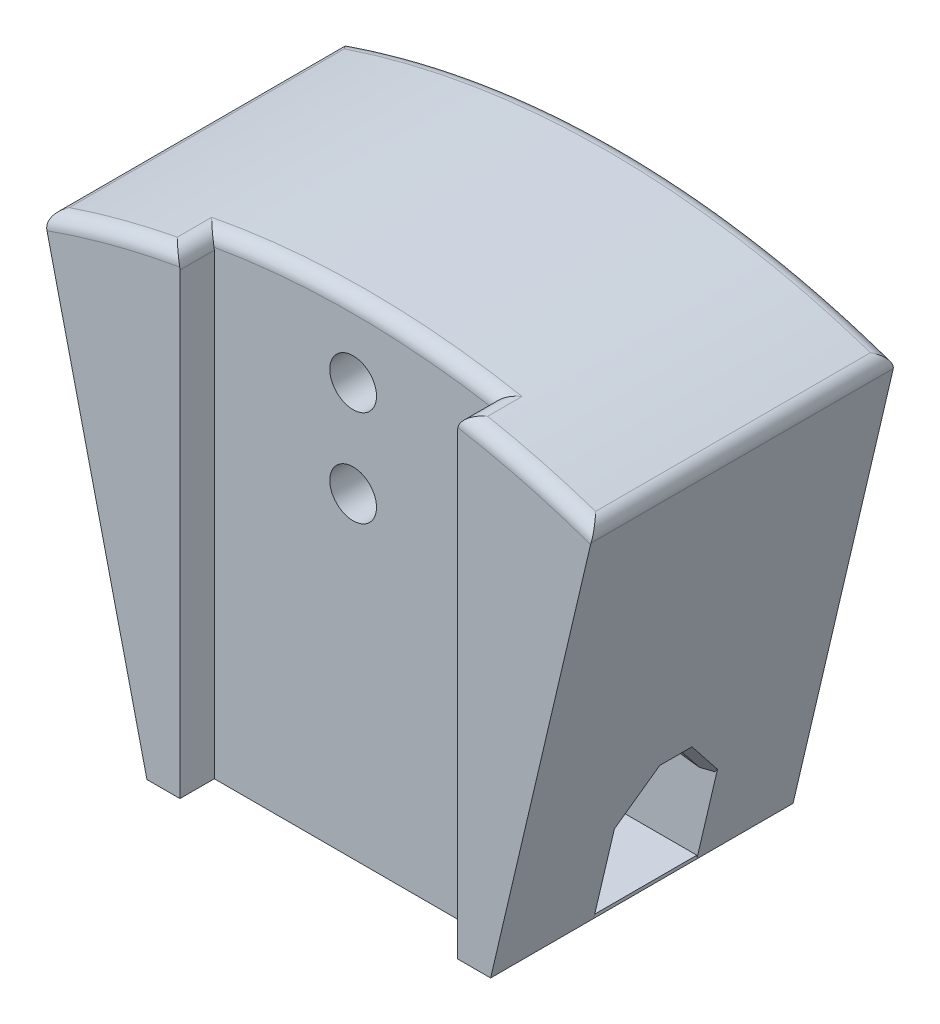
from build123d import *
from OCP.BRepFilletAPI import BRepFilletAPI_MakeChamfer

# Parameters (mm, degrees)
BOSS_EXTRUDE1_DEPTH     = 13.97
SKETCH5_W               = 25.654
SKETCH5_H               = 76.2
CUT_EXTRUDE3_DEPTH      = 3.175
CUT_EXTRUDE5_DEPTH      = 48.905647425
CUT_EXTRUDE5_DEPTH_BACK = 48.905647425
SKETCH8_R               = 2.159
SKETCH6_W               = 9.525
SKETCH6_H               = 13.97
CUT_EXTRUDE4_DEPTH      = 9.525
CUT_EXTRUDE1_DEPTH      = 22.225
CUT_EXTRUDE6_DEPTH      = 5
CUT_EXTRUDE8_DEPTH      = 44.32212749
CUT_EXTRUDE8_DEPTH_BACK = 44.32212749
CHAMFER1_SIZE           = 0.682114001
CHAMFER1_SIZE_2         = 0.508
CHAMFER1_SIZE_3         = 0.603255048
CHAMFER2_SIZE           = 0.508
CHAMFER2_SIZE2          = 0.71158035
CHAMFER2_SIZE2_2        = 0.968183523
FILLET2_R               = 1.27
SKETCH11_W              = 31.75
SKETCH11_H              = 9.525
BOSS_EXTRUDE3_DEPTH     = 0.3


with BuildPart() as part:
    # Sketch1 → Boss-Extrude1 (new, symmetric)
    with BuildSketch(Plane.XY):
        with BuildLine():
            Line((-15.875, -12.7), (-25.4, 27.836548969))
            ThreePointArc((-25.4, 27.836548969), (0, 32.1945), (25.4, 27.836548969))
            Line((25.4, 27.836548969), (15.875, -12.7))
            Line((15.875, -12.7), (-15.875, -12.7))
        make_face()
    extrude(amount=BOSS_EXTRUDE1_DEPTH, both=True)

    # Sketch5 → Cut-Extrude3 (cut)
    with BuildSketch(Plane.XY.offset(13.97)):
        with Locations((0, 25.4)):
            Rectangle(SKETCH5_W, SKETCH5_H)
    extrude(amount=-CUT_EXTRUDE3_DEPTH, mode=Mode.SUBTRACT)

    # Sketch8 → Cut-Extrude5 (cut, two sides: drawn at the far end of the back side and taken through both)
    with BuildSketch(Plane.XY.offset(10.795).offset(-CUT_EXTRUDE5_DEPTH_BACK)):
        with Locations((0, 16.51)):
            Circle(SKETCH8_R)
        with Locations((0, 25.4)):
            Circle(SKETCH8_R)
    extrude(amount=CUT_EXTRUDE5_DEPTH + CUT_EXTRUDE5_DEPTH_BACK, mode=Mode.SUBTRACT)

    # Sketch6 → Cut-Revolve2 (revolve, cut)
    with BuildSketch(Plane(origin=(0, 0, 0), x_dir=(0, 0, -1), z_dir=(1, 0, 0))):
        with Locations((0.3175, 6.985)):
            Rectangle(SKETCH6_W, SKETCH6_H)
    revolve(axis=Axis((0, 0, 20.955), (0, 0, -1)), mode=Mode.SUBTRACT)

    # Sketch7 → Cut-Extrude4 (cut)
    with BuildSketch(Plane(origin=(0, 0, -5.08), x_dir=(-1, 0, 0), z_dir=(0, 0, -1))):
        with BuildLine():
            Line((12.838226341, 5.508252391), (17.564867483, -5.508252391))
            Line((17.564867483, -5.508252391), (15.875, -12.7))
            Line((15.875, -12.7), (-15.875, -12.7))
            Line((-15.875, -12.7), (-17.564867483, -5.508252391))
            Line((-17.564867483, -5.508252391), (-12.838226341, 5.508252391))
            ThreePointArc((-12.838226341, 5.508252391), (0, 13.97), (12.838226341, 5.508252391))
        make_face()
    extrude(amount=-CUT_EXTRUDE4_DEPTH, mode=Mode.SUBTRACT)

    # Sketch3 → Cut-Extrude1 (cut)
    with BuildSketch(Plane(origin=(0, 0, -13.97), x_dir=(-1, 0, 0), z_dir=(0, 0, -1))):
        Polygon((6.5405, -3.776159436), (6.5405, 3.776159436), (0, 7.552318871), (-6.5405, 3.776159436), (-6.5405, -3.776159436), (0, -7.552318871), align=None)
    extrude(amount=-CUT_EXTRUDE1_DEPTH, mode=Mode.SUBTRACT)

    # Sketch9 → Cut-Extrude6 (cut)
    with BuildSketch(Plane(origin=(0, 0, -13.97), x_dir=(-1, 0, 0), z_dir=(0, 0, -1))):
        Polygon((3.625, 23.307105274), (3.625, 27.492894726), (0, 29.585789452), (-3.625, 27.492894726), (-3.625, 23.307105274), (0, 21.214210548), align=None)
        Polygon((3.625, 18.602894726), (0, 20.695789452), (-3.625, 18.602894726), (-3.625, 14.417105274), (0, 12.324210548), (3.625, 14.417105274), align=None)
    extrude(amount=-CUT_EXTRUDE6_DEPTH, mode=Mode.SUBTRACT)

    # Sketch10 → Cut-Extrude8 (cut, two sides: drawn at the far end of the back side and taken through both)
    with BuildSketch(Plane(origin=(0, 0, 0), x_dir=(0, 0, -1), z_dir=(1, 0, 0)).offset(-CUT_EXTRUDE8_DEPTH_BACK)):
        Polygon((-4.445, -5.508252391), (-0.9525, -1.346052969), (1.5875, -1.346052969), (5.08, -5.508252391), align=None)
    extrude(amount=CUT_EXTRUDE8_DEPTH + CUT_EXTRUDE8_DEPTH_BACK, mode=Mode.SUBTRACT)

    # Chamfer1
    # the kernel refuses this chamfer: 0.682114001, 0.603255048, 0.508 mm, written as the material it takes off along each edge
    with BuildSketch(Plane(origin=(-18.54287253, -1.346052969, -3.351137705), x_dir=(-0.24852335816266743, 0.968625903250347, 0), z_dir=(0, 0, 1))) as chamfer1_piece_1_section:
        Polygon((CHAMFER1_SIZE * 0.999792559209, -CHAMFER1_SIZE * 0.0203675757071), (-CHAMFER1_SIZE_2 * 0.248523358163, -CHAMFER1_SIZE_2 * 0.96862590325), (0, 0), align=None)
    chamfer1_piece_1 = extrude(amount=6.06727541, mode=Mode.PRIVATE)
    chamfer1_piece_1 = split(chamfer1_piece_1, bisect_by=Plane(origin=(-18.413842957, -0.601935265, 0.328111109), z_dir=(0, -0.642787609686538, -0.7660444431189792)), keep=Keep.TOP, mode=Mode.PRIVATE)
    chamfer1_piece_1 = split(chamfer1_piece_1, bisect_by=Plane(origin=(-18.413842957, -0.601935265, -0.963111109), z_dir=(0, -0.6427876096865379, 0.7660444431189793)), keep=Keep.TOP, mode=Mode.PRIVATE)
    add(chamfer1_piece_1, mode=Mode.SUBTRACT)
    with BuildSketch(Plane(origin=(18.54287253, -1.346052969, 2.716137705), x_dir=(0.2485233581626668, 0.968625903250347, 0), z_dir=(0, 0, -1))) as chamfer1_piece_2_section:
        Polygon((CHAMFER1_SIZE * 0.999792559209, -CHAMFER1_SIZE * 0.0203675757071), (-CHAMFER1_SIZE_2 * 0.248523358163, -CHAMFER1_SIZE_2 * 0.96862590325), (0, 0), align=None)
    chamfer1_piece_2 = extrude(amount=6.06727541, mode=Mode.PRIVATE)
    chamfer1_piece_2 = split(chamfer1_piece_2, bisect_by=Plane(origin=(18.413842957, -0.601935265, -0.963111109), z_dir=(0, -0.6427876096865379, 0.7660444431189793)), keep=Keep.TOP, mode=Mode.PRIVATE)
    chamfer1_piece_2 = split(chamfer1_piece_2, bisect_by=Plane(origin=(18.413842957, -0.601935265, 0.328111109), z_dir=(0, -0.642787609686538, -0.7660444431189792)), keep=Keep.TOP, mode=Mode.PRIVATE)
    add(chamfer1_piece_2, mode=Mode.SUBTRACT)
    # the kernel refuses this chamfer: 0.682114001, 0.603255048, 0.508 mm, written as the material it takes off along each edge
    with BuildSketch(Plane(origin=(-18.974731516, 0.491854947, -0.589687854), x_dir=(-0.16712797510609614, 0.6104069372998713, 0.774255520376269), z_dir=(0.1771528691217366, -0.753928184154646, 0.6326208612583173))) as chamfer1_2_piece_1_section:
        Polygon((CHAMFER1_SIZE_3 * 0.999733841967, -CHAMFER1_SIZE_3 * 0.0230704135301), (-CHAMFER1_SIZE_2 * 0.169813861997, -CHAMFER1_SIZE_2 * 0.985476155101), (0, 0), align=None)
    chamfer1_2_piece_1 = extrude(amount=9.515476986, mode=Mode.PRIVATE)
    chamfer1_2_piece_1 = split(chamfer1_2_piece_1, bisect_by=Plane(origin=(-18.030163658, -1.346052969, 0.957818648), z_dir=(0, -1, 0)), keep=Keep.TOP, mode=Mode.PRIVATE)
    chamfer1_2_piece_1 = split(chamfer1_2_piece_1, bisect_by=Plane(origin=(-18.030163658, -1.348720845, 4.445), z_dir=(0, 0, -1)), keep=Keep.TOP, mode=Mode.PRIVATE)
    add(chamfer1_2_piece_1, mode=Mode.SUBTRACT)
    with BuildSketch(Plane(origin=(-18.974731516, 0.491854947, -0.589687854), x_dir=(-0.16712797510609614, 0.6104069372998713, 0.774255520376269), z_dir=(0.1771528691217366, -0.753928184154646, 0.6326208612583173))) as chamfer1_2_piece_2_section:
        Polygon((CHAMFER1_SIZE_3 * 0.999733841967, -CHAMFER1_SIZE_3 * 0.0230704135301), (-CHAMFER1_SIZE_2 * 0.169813861997, -CHAMFER1_SIZE_2 * 0.985476155101), (0, 0), align=None)
    chamfer1_2_piece_2 = extrude(amount=9.515476986, mode=Mode.PRIVATE)
    chamfer1_2_piece_2 = split(chamfer1_2_piece_2, bisect_by=Plane(origin=(-18.378233005, -1.002692494, 1.0369902), z_dir=(-0.7071067811865488, -0.7071067811865464, 0)), keep=Keep.TOP, mode=Mode.PRIVATE)
    chamfer1_2_piece_2 = split(chamfer1_2_piece_2, bisect_by=Plane(origin=(-18.473233886, -1.097693375, 4.445), z_dir=(0, 0, -1)), keep=Keep.TOP, mode=Mode.PRIVATE)
    add(chamfer1_2_piece_2, mode=Mode.SUBTRACT)
    with BuildSketch(Plane(origin=(17.289037466, -6.682131338, 5.430001392), x_dir=(0.16712797510609612, 0.6104069372998716, 0.7742555203762688), z_dir=(0.1771528691217377, 0.7539281841546455, -0.6326208612583175))) as chamfer1_2_piece_3_section:
        Polygon((CHAMFER1_SIZE_3 * 0.999733841967, -CHAMFER1_SIZE_3 * 0.0230704135301), (-CHAMFER1_SIZE_2 * 0.169813861997, -CHAMFER1_SIZE_2 * 0.985476155101), (0, 0), align=None)
    chamfer1_2_piece_3 = extrude(amount=9.515476986, mode=Mode.PRIVATE)
    chamfer1_2_piece_3 = split(chamfer1_2_piece_3, bisect_by=Plane(origin=(17.932422067, -3.21764052, 4.445), z_dir=(0, 0, -1)), keep=Keep.TOP, mode=Mode.PRIVATE)
    chamfer1_2_piece_3 = split(chamfer1_2_piece_3, bisect_by=Plane(origin=(17.047853524, -2.333071976, 2.777240675), z_dir=(0.7071067811865496, -0.7071067811865455, 0)), keep=Keep.TOP, mode=Mode.PRIVATE)
    add(chamfer1_2_piece_3, mode=Mode.SUBTRACT)
    with BuildSketch(Plane(origin=(17.289037466, -6.682131338, 5.430001392), x_dir=(0.16712797510609612, 0.6104069372998716, 0.7742555203762688), z_dir=(0.1771528691217377, 0.7539281841546455, -0.6326208612583175))) as chamfer1_2_piece_4_section:
        Polygon((CHAMFER1_SIZE_3 * 0.999733841967, -CHAMFER1_SIZE_3 * 0.0230704135301), (-CHAMFER1_SIZE_2 * 0.169813861997, -CHAMFER1_SIZE_2 * 0.985476155101), (0, 0), align=None)
    chamfer1_2_piece_4 = extrude(amount=9.515476986, mode=Mode.PRIVATE)
    chamfer1_2_piece_4 = split(chamfer1_2_piece_4, bisect_by=Plane(origin=(18.030163658, -1.346052969, 0.957818648), z_dir=(0, -1, 0)), keep=Keep.TOP, mode=Mode.PRIVATE)
    chamfer1_2_piece_4 = split(chamfer1_2_piece_4, bisect_by=Plane(origin=(18.031184156, -1.349741343, 0.957818648), z_dir=(-0.7071067811865496, 0.7071067811865455, 0)), keep=Keep.TOP, mode=Mode.PRIVATE)
    add(chamfer1_2_piece_4, mode=Mode.SUBTRACT)
    with BuildSketch(Plane(origin=(-17.289037466, -6.682131338, -6.065001392), x_dir=(-0.16712797510609537, 0.6104069372998713, -0.7742555203762692), z_dir=(-0.17715286912173667, 0.7539281841546462, 0.6326208612583171))) as chamfer1_2_piece_5_section:
        Polygon((CHAMFER1_SIZE_3 * 0.999733841967, -CHAMFER1_SIZE_3 * 0.0230704135301), (-CHAMFER1_SIZE_2 * 0.169813861997, -CHAMFER1_SIZE_2 * 0.985476155101), (0, 0), align=None)
    chamfer1_2_piece_5 = extrude(amount=9.515476986, mode=Mode.PRIVATE)
    chamfer1_2_piece_5 = split(chamfer1_2_piece_5, bisect_by=Plane(origin=(-17.932422067, -1.346052969, -3.412240675), z_dir=(0, -1, 0)), keep=Keep.TOP, mode=Mode.PRIVATE)
    chamfer1_2_piece_5 = split(chamfer1_2_piece_5, bisect_by=Plane(origin=(-17.932422067, -3.21764052, -5.08), z_dir=(0, 0, 1)), keep=Keep.TOP, mode=Mode.PRIVATE)
    add(chamfer1_2_piece_5, mode=Mode.SUBTRACT)
    with BuildSketch(Plane(origin=(-17.289037466, -6.682131338, -6.065001392), x_dir=(-0.16712797510609537, 0.6104069372998713, -0.7742555203762692), z_dir=(-0.17715286912173667, 0.7539281841546462, 0.6326208612583171))) as chamfer1_2_piece_6_section:
        Polygon((CHAMFER1_SIZE_3 * 0.999733841967, -CHAMFER1_SIZE_3 * 0.0230704135301), (-CHAMFER1_SIZE_2 * 0.169813861997, -CHAMFER1_SIZE_2 * 0.985476155101), (0, 0), align=None)
    chamfer1_2_piece_6 = extrude(amount=9.515476986, mode=Mode.PRIVATE)
    chamfer1_2_piece_6 = split(chamfer1_2_piece_6, bisect_by=Plane(origin=(-18.378233005, -1.002692494, -1.6719902), z_dir=(-0.7071067811865488, -0.7071067811865464, 0)), keep=Keep.TOP, mode=Mode.PRIVATE)
    chamfer1_2_piece_6 = split(chamfer1_2_piece_6, bisect_by=Plane(origin=(-18.473233886, -1.097693375, -5.08), z_dir=(0, 0, 1)), keep=Keep.TOP, mode=Mode.PRIVATE)
    add(chamfer1_2_piece_6, mode=Mode.SUBTRACT)
    with BuildSketch(Plane(origin=(18.974731516, 0.491854947, -0.045312146), x_dir=(0.16712797510609612, 0.610406937299871, -0.774255520376269), z_dir=(-0.17715286912173778, -0.7539281841546458, -0.6326208612583172))) as chamfer1_2_piece_7_section:
        Polygon((CHAMFER1_SIZE_3 * 0.999733841967, -CHAMFER1_SIZE_3 * 0.0230704135301), (-CHAMFER1_SIZE_2 * 0.169813861997, -CHAMFER1_SIZE_2 * 0.985476155101), (0, 0), align=None)
    chamfer1_2_piece_7 = extrude(amount=9.515476986, mode=Mode.PRIVATE)
    chamfer1_2_piece_7 = split(chamfer1_2_piece_7, bisect_by=Plane(origin=(18.030163658, -1.346052969, -1.592818648), z_dir=(0, -1, 0)), keep=Keep.TOP, mode=Mode.PRIVATE)
    chamfer1_2_piece_7 = split(chamfer1_2_piece_7, bisect_by=Plane(origin=(18.030163658, -1.348720845, -5.08), z_dir=(0, 0, 1)), keep=Keep.TOP, mode=Mode.PRIVATE)
    add(chamfer1_2_piece_7, mode=Mode.SUBTRACT)
    with BuildSketch(Plane(origin=(18.974731516, 0.491854947, -0.045312146), x_dir=(0.16712797510609612, 0.610406937299871, -0.774255520376269), z_dir=(-0.17715286912173778, -0.7539281841546458, -0.6326208612583172))) as chamfer1_2_piece_8_section:
        Polygon((CHAMFER1_SIZE_3 * 0.999733841967, -CHAMFER1_SIZE_3 * 0.0230704135301), (-CHAMFER1_SIZE_2 * 0.169813861997, -CHAMFER1_SIZE_2 * 0.985476155101), (0, 0), align=None)
    chamfer1_2_piece_8 = extrude(amount=9.515476986, mode=Mode.PRIVATE)
    chamfer1_2_piece_8 = split(chamfer1_2_piece_8, bisect_by=Plane(origin=(18.378233005, -1.002692494, -1.6719902), z_dir=(0.7071067811865496, -0.7071067811865455, 0)), keep=Keep.TOP, mode=Mode.PRIVATE)
    chamfer1_2_piece_8 = split(chamfer1_2_piece_8, bisect_by=Plane(origin=(18.473233886, -1.097693375, -5.08), z_dir=(0, 0, 1)), keep=Keep.TOP, mode=Mode.PRIVATE)
    add(chamfer1_2_piece_8, mode=Mode.SUBTRACT)

    # Chamfer2: one chamfer whose edges measure the first distance from different faces: ONE call of the kernel's chamfer builder (chamfer() names one face for all edges)
    chamfer2_edges_1 = [part.edges().sort_by_distance(p)[0] for p in [
        (-16.505213328, -3.03848904, 2.372622483),
    ]]
    chamfer2_side_1 = [part.faces().sort_by_distance(p)[0] for p in [
        (-17.0123784, -2.474343683, 1.899248322),
    ]]
    chamfer2_edges_2 = [part.edges().sort_by_distance(p)[0] for p in [
        (-15.779072132, -1.346052969, -0.3175),
    ]]
    chamfer2_side_2 = [part.faces().sort_by_distance(p)[0] for p in [
        (-16.906992082, -1.346052969, -0.3175),
    ]]
    chamfer2_edges_3 = [part.edges().sort_by_distance(p)[0] for p in [
        (-16.505213328, -3.03848904, -3.007622483),
    ]]
    chamfer2_side_3 = [part.faces().sort_by_distance(p)[0] for p in [
        (-17.0123784, -2.474343683, -2.534248322),
    ]]
    chamfer2_edges_4 = [part.edges().sort_by_distance(p)[0] for p in [
        (16.505213328, -3.03848904, 2.372622483),
    ]]
    chamfer2_side_4 = [part.faces().sort_by_distance(p)[0] for p in [
        (17.0123784, -2.474343683, 1.899248322),
    ]]
    chamfer2_edges_5 = [part.edges().sort_by_distance(p)[0] for p in [
        (15.779072132, -1.346052969, -0.3175),
    ]]
    chamfer2_side_5 = [part.faces().sort_by_distance(p)[0] for p in [
        (16.906992082, -1.346052969, -0.3175),
    ]]
    chamfer2_edges_6 = [part.edges().sort_by_distance(p)[0] for p in [
        (16.505213328, -3.03848904, -3.007622483),
    ]]
    chamfer2_side_6 = [part.faces().sort_by_distance(p)[0] for p in [
        (17.0123784, -2.474343683, -2.534248322),
    ]]
    chamfer2 = BRepFilletAPI_MakeChamfer(part.part.solid().wrapped)
    for e in chamfer2_edges_1:
        chamfer2.Add(CHAMFER2_SIZE, CHAMFER2_SIZE2, e.wrapped, chamfer2_side_1[0].wrapped)  # the first distance lies on this face
    for e in chamfer2_edges_2:
        chamfer2.Add(CHAMFER2_SIZE, CHAMFER2_SIZE2_2, e.wrapped, chamfer2_side_2[0].wrapped)  # the first distance lies on this face
    for e in chamfer2_edges_3:
        chamfer2.Add(CHAMFER2_SIZE, CHAMFER2_SIZE2, e.wrapped, chamfer2_side_3[0].wrapped)  # the first distance lies on this face
    for e in chamfer2_edges_4:
        chamfer2.Add(CHAMFER2_SIZE, CHAMFER2_SIZE2, e.wrapped, chamfer2_side_4[0].wrapped)  # the first distance lies on this face
    for e in chamfer2_edges_5:
        chamfer2.Add(CHAMFER2_SIZE, CHAMFER2_SIZE2_2, e.wrapped, chamfer2_side_5[0].wrapped)  # the first distance lies on this face
    for e in chamfer2_edges_6:
        chamfer2.Add(CHAMFER2_SIZE, CHAMFER2_SIZE2, e.wrapped, chamfer2_side_6[0].wrapped)  # the first distance lies on this face
    add(Compound.cast(chamfer2.Shape()), mode=Mode.REPLACE)

    # Fillet2
    # the kernel refuses this fillet: 1.27 mm, written as the material it takes off along each edge
    with BuildSketch(Plane(origin=(0, -44.0055, 13.97), x_dir=(-0.37231655097771355, 0.9281058053196627, 0), z_dir=(-0.9281058053196627, -0.37231655097771355, 0))) as fillet2_piece_1:
        with BuildLine():
            CenterArc((76.2 - FILLET2_R, FILLET2_R), FILLET2_R, 270, 90)
            Line((76.2 - FILLET2_R, 0), (76.2, 0))
            Line((76.2, 0), (76.2, FILLET2_R))
        make_face()
    revolve(axis=Axis((0, -44.0055, 13.97), (0, 0, -1)), revolution_arc=14.554961915, mode=Mode.SUBTRACT)
    with BuildSketch(Plane(origin=(12.827, 31.107135894, 10.795), x_dir=(0.9839864121726662, -0.17824348700461348, 0), z_dir=(0, 0, 1))) as fillet2_piece_2:
        with BuildLine():
            CenterArc((1.520709788, -1.269935705), FILLET2_R, 89.423465076, 100.843999504)
            Line((0.271047045, -1.496304934), (0, 0))
            ThreePointArc((0, 0), (0.766744431, 0.00385769), (1.533488862, 0))
        make_face()
    extrude(amount=7.008722155, mode=Mode.SUBTRACT)
    with BuildSketch(Plane(origin=(-12.827, 31.107135894, 10.795), x_dir=(-0.983986412172668, -0.17824348700460368, 0), z_dir=(0, 0, 1))) as fillet2_piece_3:
        with BuildLine():
            CenterArc((1.520709788, 1.269935705), FILLET2_R, 169.73253542, 100.843999504)
            Line((0.271047045, 1.496304934), (0, 0))
            ThreePointArc((0, 0), (0.766744431, -0.00385769), (1.533488862, 0))
        make_face()
    extrude(amount=7.008722155, mode=Mode.SUBTRACT)
    with BuildSketch(Plane(origin=(0, -44.0055, 10.795), x_dir=(0.20924819614640747, 0.9778625631495843, 0), z_dir=(0.9778625631495843, -0.20924819614640747, 0))) as fillet2_piece_4_section:
        with BuildLine():
            CenterArc((76.2 - FILLET2_R, -FILLET2_R), FILLET2_R, 0, 90)
            Line((76.2 - FILLET2_R, 0), (76.2, 0))
            Line((76.2, 0), (76.2, -FILLET2_R))
        make_face()
    fillet2_piece_4 = revolve(axis=Axis((0, -44.0055, 10.795), (0, 0, 1)), revolution_arc=24.156596533, mode=Mode.PRIVATE)
    fillet2_piece_4 = split(fillet2_piece_4, bisect_by=Plane(origin=(-12.827, 31.838059606, 10.438559606), z_dir=(1, 0, 0)), keep=Keep.TOP, mode=Mode.PRIVATE)
    fillet2_piece_4 = split(fillet2_piece_4, bisect_by=Plane(origin=(12.827, 31.838059606, 10.438559606), z_dir=(-1, 0, 0)), keep=Keep.TOP, mode=Mode.PRIVATE)
    add(fillet2_piece_4, mode=Mode.SUBTRACT)
    with BuildSketch(Plane(origin=(0, -44.0055, 13.97), x_dir=(0.12712683029566407, 0.9918864698235265, 0), z_dir=(-0.9918864698235265, 0.12712683029566407, 0))) as fillet2_piece_5:
        with BuildLine():
            CenterArc((76.2 - FILLET2_R, FILLET2_R), FILLET2_R, 270, 90)
            Line((76.2 - FILLET2_R, 0), (76.2, 0))
            Line((76.2, 0), (76.2, FILLET2_R))
        make_face()
    revolve(axis=Axis((0, -44.0055, 13.97), (0, 0, -1)), revolution_arc=14.554961915, mode=Mode.SUBTRACT)
    with BuildSketch(Plane(origin=(0, -44.0055, -13.97), x_dir=(-0.37231927534086834, 0.9281047124164659, 0), z_dir=(-0.9281047124164659, -0.37231927534086834, 0))) as fillet2_piece_6:
        with BuildLine():
            CenterArc((76.2 - FILLET2_R, -FILLET2_R), FILLET2_R, 0, 90)
            Line((76.2, -FILLET2_R), (76.2, 0))
            Line((76.2, 0), (76.2 - FILLET2_R, 0))
        make_face()
    revolve(axis=Axis((0, -44.0055, -13.97), (0, 0, -1)), revolution_arc=43.717448578, mode=Mode.SUBTRACT)
    with BuildSketch(Plane(origin=(25.4, 27.836548969, -16.862281293), x_dir=(-0.22874324291129688, -0.9734867892387772, 0), z_dir=(0, 0, 1))) as fillet2_piece_7:
        with BuildLine():
            CenterArc((1.147231071, -1.27), FILLET2_R, 90, 84.621777916)
            ThreePointArc((-0.117177961, -1.150963031), (-0.060773335, -0.575259129), (0, 0))
            Line((0, 0), (1.147231071, 0))
        make_face()
    extrude(amount=33.724562586, mode=Mode.SUBTRACT)
    with BuildSketch(Plane(origin=(-25.4, 27.836548969, -16.862281293), x_dir=(0.22874324291129516, -0.9734867892387776, 0), z_dir=(0, 0, 1))) as fillet2_piece_8:
        with BuildLine():
            CenterArc((1.147231071, 1.27), FILLET2_R, 185.378222084, 84.621777916)
            ThreePointArc((-0.117177961, 1.150963031), (-0.060773335, 0.575259129), (0, 0))
            Line((0, 0), (1.147231071, 0))
        make_face()
    extrude(amount=33.724562586, mode=Mode.SUBTRACT)
    with BuildSketch(Plane(origin=(0, -44.0055, 10.795), x_dir=(0.20924819614640747, 0.9778625631495843, 0), z_dir=(0.9778625631495843, -0.20924819614640747, 0))) as fillet2_piece_9a_section:
        with BuildLine():
            CenterArc((76.2 - FILLET2_R, -FILLET2_R), FILLET2_R, 0, 90)
            Line((76.2 - FILLET2_R, 0), (76.2, 0))
            Line((76.2, 0), (76.2, -FILLET2_R))
        make_face()
    fillet2_piece_9a = revolve(axis=Axis((0, -44.0055, 10.795), (0, 0, 1)), revolution_arc=24.156596533, mode=Mode.PRIVATE)
    fillet2_piece_9a = split(fillet2_piece_9a, bisect_by=Plane(origin=(12.827, 30.536502101, 10.50445679), z_dir=(1, 0, 0)), keep=Keep.TOP, mode=Mode.PRIVATE)
    with BuildSketch(Plane(origin=(12.827, 31.107135894, 6.961277845), x_dir=(0.9839864121726647, -0.17824348700462206, 0), z_dir=(0, 0, 1))) as fillet2_piece_9b_section:
        with BuildLine():
            CenterArc((1.520709788, -1.269935705), FILLET2_R, 89.423465076, 100.843999504)
            Line((0.271047045, -1.496304934), (0, 0))
            ThreePointArc((0, 0), (0.766744431, 0.00385769), (1.533488862, 0))
        make_face()
    fillet2_piece_9b = extrude(amount=10.84244431, mode=Mode.PRIVATE)
    fillet2_piece_9b = split(fillet2_piece_9b, bisect_by=Plane(origin=(13.177108213, 30.693922497, 10.795), z_dir=(0, 0, -1)), keep=Keep.TOP, mode=Mode.PRIVATE)
    fillet2_piece_9 = fillet2_piece_9a & fillet2_piece_9b
    add(fillet2_piece_9, mode=Mode.SUBTRACT)
    with BuildSketch(Plane(origin=(-12.827, 31.107135894, 6.961277845), x_dir=(-0.9839864121726664, -0.17824348700461268, 0), z_dir=(0, 0, 1))) as fillet2_piece_10a_section:
        with BuildLine():
            CenterArc((1.520709788, 1.269935705), FILLET2_R, 169.73253542, 100.843999504)
            Line((0.271047045, 1.496304934), (0, 0))
            ThreePointArc((0, 0), (0.766744431, -0.00385769), (1.533488862, 0))
        make_face()
    fillet2_piece_10a = extrude(amount=10.84244431, mode=Mode.PRIVATE)
    fillet2_piece_10a = split(fillet2_piece_10a, bisect_by=Plane(origin=(-13.177108213, 30.693922497, 10.795), z_dir=(0, 0, -1)), keep=Keep.TOP, mode=Mode.PRIVATE)
    with BuildSketch(Plane(origin=(0, -44.0055, 10.795), x_dir=(0.20924819614640747, 0.9778625631495843, 0), z_dir=(0.9778625631495843, -0.20924819614640747, 0))) as fillet2_piece_10b_section:
        with BuildLine():
            CenterArc((76.2 - FILLET2_R, -FILLET2_R), FILLET2_R, 0, 90)
            Line((76.2 - FILLET2_R, 0), (76.2, 0))
            Line((76.2, 0), (76.2, -FILLET2_R))
        make_face()
    fillet2_piece_10b = revolve(axis=Axis((0, -44.0055, 10.795), (0, 0, 1)), revolution_arc=24.156596533, mode=Mode.PRIVATE)
    fillet2_piece_10b = split(fillet2_piece_10b, bisect_by=Plane(origin=(-12.827, 30.536502326, 10.504456748), z_dir=(-1, 0, 0)), keep=Keep.TOP, mode=Mode.PRIVATE)
    fillet2_piece_10 = fillet2_piece_10a & fillet2_piece_10b
    add(fillet2_piece_10, mode=Mode.SUBTRACT)

    # Sketch11 → Boss-Extrude3 (add)
    with BuildSketch(Plane.XZ.offset(12.7)):
        with Locations((0, -0.3175)):
            Rectangle(SKETCH11_W, SKETCH11_H)
    extrude(amount=-BOSS_EXTRUDE3_DEPTH)


solid = part.part
